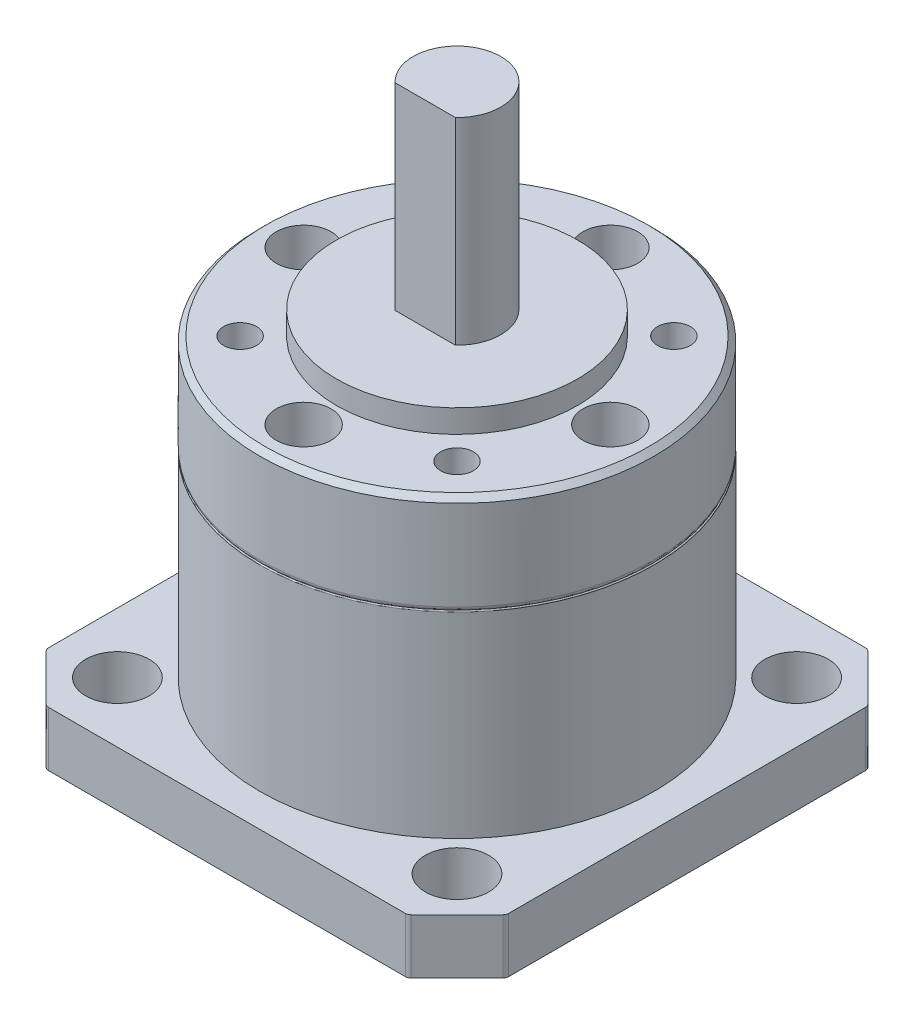
from build123d import *

# Parameters (mm, degrees)
SKETCH1_R           = 2.9
BOSS_EXTRUDE1_DEPTH = 5
SKETCH2_R           = 18
BOSS_EXTRUDE2_DEPTH = 18
FILLET1_R           = 0.1
FILLET2_R           = 0.5
SKETCH4_R           = 18
BOSS_EXTRUDE3_DEPTH = 9
FILLET3_R           = 0.5
CHAMFER1_SIZE       = 0.5
SKETCH6_R           = 2.5
SKETCH6_R_2         = 1.5
CUT_EXTRUDE1_DEPTH  = 9
SKETCH7_R           = 11
BOSS_EXTRUDE4_DEPTH = 2.1
BOSS_EXTRUDE5_DEPTH = 18


with BuildPart() as part:
    # Sketch1 → Boss-Extrude1 (new body)
    with BuildSketch(Plane(origin=(0, 0, 0), x_dir=(1, 0, 0), z_dir=(0, 1, 0))):
        Polygon((4.5, 0), (37.5, 0), (42, 4.5), (42, 37.5), (37.5, 42), (4.5, 42), (0, 37.5), (0, 4.5), align=None)
        with Locations(Location((5.5, 36.5, 0), (0, 0, 270))):
            Circle(SKETCH1_R, mode=Mode.SUBTRACT)
        with Locations(Location((36.5, 36.5, 0), (0, 0, 270))):
            Circle(SKETCH1_R, mode=Mode.SUBTRACT)
        with Locations(Location((36.5, 5.5, 0), (0, 0, 270))):
            Circle(SKETCH1_R, mode=Mode.SUBTRACT)
        with Locations(Location((5.5, 5.5, 0), (0, 0, 270))):
            Circle(SKETCH1_R, mode=Mode.SUBTRACT)
    extrude(amount=BOSS_EXTRUDE1_DEPTH)

    # Sketch2 → Boss-Extrude2 (add)
    with BuildSketch(Plane(origin=(0, 5, 0), x_dir=(1, 0, 0), z_dir=(0, 1, 0))):
        with Locations(Location((21, 21, 0), (0, 0, 270))):
            Circle(SKETCH2_R)
    extrude(amount=BOSS_EXTRUDE2_DEPTH)

    # Fillet1
    fillet1_edges = [part.edges().sort_by_distance(p)[0] for p in [
        (21, 23, -39),
    ]]
    fillet(fillet1_edges, radius=FILLET1_R)

    # Fillet2
    fillet2_edges = [part.edges().sort_by_distance(p)[0] for p in [
        (4.5, 2.5, -42),
        (37.5, 2.5, -42),
        (42, 2.5, -37.5),
        (42, 2.5, -4.5),
        (37.5, 2.5, 0),
        (4.5, 2.5, 0),
        (0, 2.5, -4.5),
        (0, 2.5, -37.5),
    ]]
    fillet(fillet2_edges, radius=FILLET2_R)

    # Sketch4 → Boss-Extrude3 (add)
    with BuildSketch(Plane(origin=(0, 23, 0), x_dir=(1, 0, 0), z_dir=(0, 1, 0))):
        with Locations(Location((21, 21, 0), (0, 0, 270))):
            Circle(SKETCH4_R)
    extrude(amount=BOSS_EXTRUDE3_DEPTH)

    # Fillet3
    # the kernel refuses this fillet: 0.5 mm, written as the material it takes off along each edge
    with BuildSketch(Plane(origin=(21, 23, -21), x_dir=(0, 0, 1), z_dir=(-1, 0, 0))) as fillet3_piece_1:
        with BuildLine():
            CenterArc((17.5, 0.3), FILLET3_R, 323.130102354, 36.869897646)
            Line((17.9, 0), (18, 0))
            Line((18, 0), (18, 0.3))
        make_face()
    revolve(axis=Axis((21, 23, -21), (0, 1, 0)), mode=Mode.SUBTRACT)

    # Chamfer1
    chamfer1_edges = [part.edges().sort_by_distance(p)[0] for p in [
        (21, 32, -39),
    ]]
    chamfer(chamfer1_edges, length=CHAMFER1_SIZE)

    # Sketch6 → Cut-Extrude1 (cut)
    with BuildSketch(Plane(origin=(0, 32, 0), x_dir=(1, 0, 0), z_dir=(0, 1, 0))):
        with Locations(Location((7, 21, 0), (0, 0, 270))):
            Circle(SKETCH6_R)
        with Locations(Location((21, 35, 0), (0, 0, 270))):
            Circle(SKETCH6_R)
        with Locations(Location((35, 21, 0), (0, 0, 270))):
            Circle(SKETCH6_R)
        with Locations(Location((21, 7, 0), (0, 0, 270))):
            Circle(SKETCH6_R)
        with Locations(Location((11.100505063, 11.100505063, 0), (0, 0, 270))):
            Circle(SKETCH6_R_2)
        with Locations(Location((11.100505063, 30.899494937, 0), (0, 0, 270))):
            Circle(SKETCH6_R_2)
        with Locations(Location((30.899494937, 30.899494937, 0), (0, 0, 270))):
            Circle(SKETCH6_R_2)
        with Locations(Location((30.899494937, 11.100505063, 0), (0, 0, 270))):
            Circle(SKETCH6_R_2)
    extrude(amount=-CUT_EXTRUDE1_DEPTH, mode=Mode.SUBTRACT)

    # Sketch7 → Boss-Extrude4 (add)
    with BuildSketch(Plane(origin=(0, 32, 0), x_dir=(1, 0, 0), z_dir=(0, 1, 0))):
        with Locations(Location((21, 21, 0), (0, 0, 270))):
            Circle(SKETCH7_R)
    extrude(amount=BOSS_EXTRUDE4_DEPTH)

    # Sketch8 → Boss-Extrude5 (add)
    with BuildSketch(Plane(origin=(0, 34.1, 0), x_dir=(1, 0, 0), z_dir=(0, 1, 0))):
        with BuildLine():
            Line((18.245004537, 18.1), (23.754995463, 18.1))
            ThreePointArc((23.754995463, 18.1), (21, 25), (18.245004537, 18.1))
        make_face()
    extrude(amount=BOSS_EXTRUDE5_DEPTH)


solid = part.part
